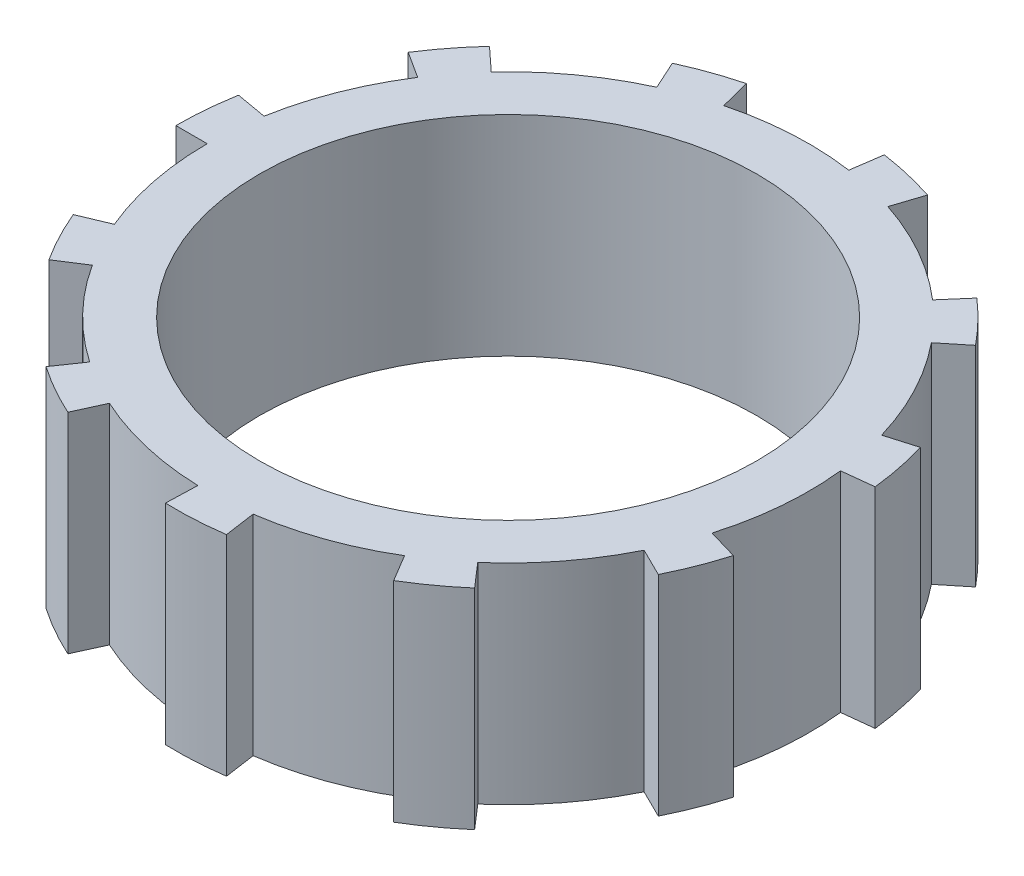
from build123d import *

# Parameters (mm, degrees)
SKETCH1_R           = 28.755
SKETCH1_R_2         = 23.755
BOSS_EXTRUDE1_DEPTH = 20
SKETCH2_W           = 3
SKETCH2_H           = 20
REVOLVE1_ANGLE      = 10
CIRPATTERN1_COUNT   = 11


with BuildPart() as part:
    # Sketch1 → Boss-Extrude1 (new body)
    with BuildSketch(Plane(origin=(0, 0, 0), x_dir=(1, 0, 0), z_dir=(0, 1, 0))):
        Circle(SKETCH1_R)
        Circle(SKETCH1_R_2, mode=Mode.SUBTRACT)
    extrude(amount=BOSS_EXTRUDE1_DEPTH)

    # Sketch2 → Revolve1 (revolve)
    with BuildSketch(Plane.XY):
        with Locations((-30.255, 10)):
            Rectangle(SKETCH2_W, SKETCH2_H)
    revolve1 = revolve(axis=Axis((0, 20, 0), (0, -1, 0)), revolution_arc=REVOLVE1_ANGLE)

    # CirPattern1: Revolve1 ×11 about axis
    cirpattern1_axis = Axis((0, 20, 0), (0, -1, 0))
    for i in range(1, CIRPATTERN1_COUNT):
        add(revolve1.rotate(cirpattern1_axis, i * 360 / CIRPATTERN1_COUNT))


solid = part.part
